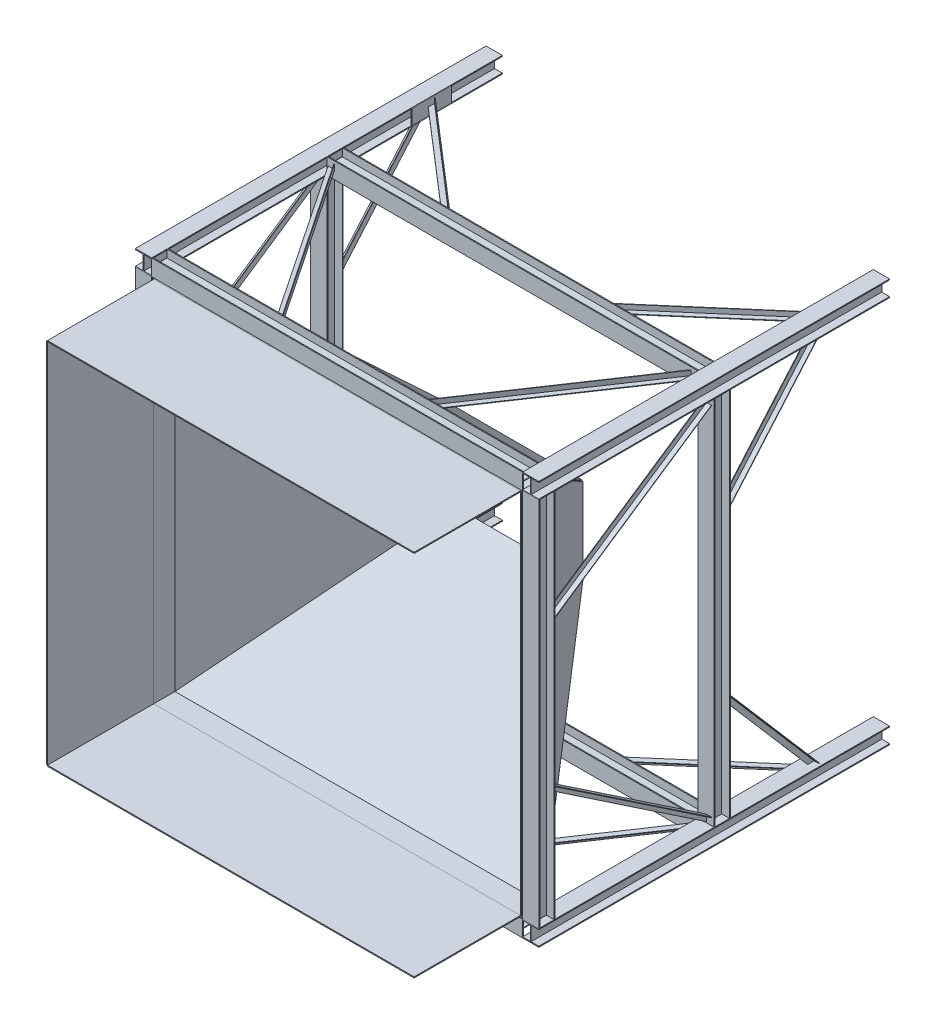
from build123d import *

# Parameters (mm, degrees)
COLUMNA_H_1_DEPTH                            = 3300
COLUMNA_H_2_DEPTH                            = 3300
COLUMNA_H_3_DEPTH                            = 3300
COLUMNA_H_4_DEPTH                            = 3300
VIGA_H_CARGA_1650_DEPTH                      = 3490
VIGA_H_CARGA_3300_DEPTH                      = 3490
CONTORNO_CIERRE_COLUMNA_CARGA_A_W            = 370
CONTORNO_CIERRE_COLUMNA_CARGA_A_H            = 135
CIERRE_COLUMNA_CARGA_A_DEPTH                 = 8
ALA_PLANA_ANGULAR_SUPERIOR_CARGA_A_DEPTH     = 5
RETORNO_ANGULAR_SUPERIOR_CARGA_A_DEPTH       = 45
ALA_PLANA_ANGULAR_INFERIOR_CARGA_A_DEPTH     = 5
RETORNO_ANGULAR_INFERIOR_CARGA_A_DEPTH       = 45
CONTORNO_CIERRE_COLUMNA_CARGA_B_W            = 370
CONTORNO_CIERRE_COLUMNA_CARGA_B_H            = 135
CIERRE_COLUMNA_CARGA_B_DEPTH                 = 8
ALA_PLANA_ANGULAR_SUPERIOR_CARGA_B_DEPTH     = 5
RETORNO_ANGULAR_SUPERIOR_CARGA_B_DEPTH       = 45
ALA_PLANA_ANGULAR_INFERIOR_CARGA_B_DEPTH     = 5
RETORNO_ANGULAR_INFERIOR_CARGA_B_DEPTH       = 45
CONTORNO_ASIENTO_SOLDADO_CARGA_W             = 2900
CONTORNO_ASIENTO_SOLDADO_CARGA_H             = 83.725
ASIENTO_SOLDADO_CARGA_DEPTH                  = 9.525
VIGA_H_FONDO_1650_DEPTH                      = 3490
VIGA_H_FONDO_3300_DEPTH                      = 3490
CONTORNO_CIERRE_COLUMNA_FONDO_A_W            = 370
CONTORNO_CIERRE_COLUMNA_FONDO_A_H            = 135
CIERRE_COLUMNA_FONDO_A_DEPTH                 = 8
ALA_PLANA_ANGULAR_SUPERIOR_FONDO_A_DEPTH     = 5
RETORNO_ANGULAR_SUPERIOR_FONDO_A_DEPTH       = 45
ALA_PLANA_ANGULAR_INFERIOR_FONDO_A_DEPTH     = 5
RETORNO_ANGULAR_INFERIOR_FONDO_A_DEPTH       = 45
CONTORNO_CIERRE_COLUMNA_FONDO_B_W            = 370
CONTORNO_CIERRE_COLUMNA_FONDO_B_H            = 135
CIERRE_COLUMNA_FONDO_B_DEPTH                 = 8
ALA_PLANA_ANGULAR_SUPERIOR_FONDO_B_DEPTH     = 5
RETORNO_ANGULAR_SUPERIOR_FONDO_B_DEPTH       = 45
ALA_PLANA_ANGULAR_INFERIOR_FONDO_B_DEPTH     = 5
RETORNO_ANGULAR_INFERIOR_FONDO_B_DEPTH       = 45
CONTORNO_ASIENTO_SOLDADO_FONDO_W             = 2900
CONTORNO_ASIENTO_SOLDADO_FONDO_H             = 83.725
ASIENTO_SOLDADO_FONDO_DEPTH                  = 9.525
VIGA_H_IZQUIERDA_1650_DEPTH                  = 3490
VIGA_H_IZQUIERDA_3300_DEPTH                  = 3490
ALA_PLANA_ANGULAR_SUPERIOR_IZQUIERDA_A_DEPTH = 5
RETORNO_ANGULAR_SUPERIOR_IZQUIERDA_A_DEPTH   = 45
ALA_PLANA_ANGULAR_INFERIOR_IZQUIERDA_A_DEPTH = 5
RETORNO_ANGULAR_INFERIOR_IZQUIERDA_A_DEPTH   = 45
ALA_PLANA_ANGULAR_SUPERIOR_IZQUIERDA_B_DEPTH = 5
RETORNO_ANGULAR_SUPERIOR_IZQUIERDA_B_DEPTH   = 45
ALA_PLANA_ANGULAR_INFERIOR_IZQUIERDA_B_DEPTH = 5
RETORNO_ANGULAR_INFERIOR_IZQUIERDA_B_DEPTH   = 45
CONTORNO_ASIENTO_SOLDADO_IZQUIERDA_W         = 83.725
CONTORNO_ASIENTO_SOLDADO_IZQUIERDA_H         = 2900
ASIENTO_SOLDADO_IZQUIERDA_DEPTH              = 9.525
VIGA_H_DERECHA_1650_DEPTH                    = 3490
VIGA_H_DERECHA_3300_DEPTH                    = 3490
ALA_PLANA_ANGULAR_SUPERIOR_DERECHA_A_DEPTH   = 5
RETORNO_ANGULAR_SUPERIOR_DERECHA_A_DEPTH     = 45
ALA_PLANA_ANGULAR_INFERIOR_DERECHA_A_DEPTH   = 5
RETORNO_ANGULAR_INFERIOR_DERECHA_A_DEPTH     = 45
ALA_PLANA_ANGULAR_SUPERIOR_DERECHA_B_DEPTH   = 5
RETORNO_ANGULAR_SUPERIOR_DERECHA_B_DEPTH     = 45
ALA_PLANA_ANGULAR_INFERIOR_DERECHA_B_DEPTH   = 5
RETORNO_ANGULAR_INFERIOR_DERECHA_B_DEPTH     = 45
CONTORNO_ASIENTO_SOLDADO_DERECHA_W           = 83.725
CONTORNO_ASIENTO_SOLDADO_DERECHA_H           = 2900
ASIENTO_SOLDADO_DERECHA_DEPTH                = 9.525
CONTORNO_COLLAR_LATERAL_Y_NEGATIVO_W         = 3450
CONTORNO_COLLAR_LATERAL_Y_NEGATIVO_H         = 200
COLLAR_LATERAL_Y_NEGATIVO_DEPTH              = 9.525
CONTORNO_ALER_N_LATERAL_Y_NEGATIVO_W         = 3450
CONTORNO_ALER_N_LATERAL_Y_NEGATIVO_H         = 1000
ALER_N_LATERAL_Y_NEGATIVO_DEPTH              = 9.525
EMBUDO_LATERAL_Y_NEGATIVO_DEPTH              = 9.525
CONTORNO_COLLAR_CARGA_W                      = 200
CONTORNO_COLLAR_CARGA_H                      = 3450
COLLAR_CARGA_DEPTH                           = 9.525
EMBUDO_CARGA_DEPTH                           = 9.525
CONTORNO_COLLAR_LATERAL_Y_POSITIVO_W         = 3450
CONTORNO_COLLAR_LATERAL_Y_POSITIVO_H         = 200
COLLAR_LATERAL_Y_POSITIVO_DEPTH              = 9.525
CONTORNO_ALER_N_LATERAL_Y_POSITIVO_W         = 3450
CONTORNO_ALER_N_LATERAL_Y_POSITIVO_H         = 1000
ALER_N_LATERAL_Y_POSITIVO_DEPTH              = 9.525
EMBUDO_LATERAL_Y_POSITIVO_DEPTH              = 9.525
CONTORNO_COLLAR_FONDO_X_NEGATIVO_W           = 200
CONTORNO_COLLAR_FONDO_X_NEGATIVO_H           = 3450
COLLAR_FONDO_X_NEGATIVO_DEPTH                = 9.525
CONTORNO_ALER_N_FONDO_X_NEGATIVO_W           = 1000
CONTORNO_ALER_N_FONDO_X_NEGATIVO_H           = 3450
ALER_N_FONDO_X_NEGATIVO_DEPTH                = 9.525
EMBUDO_FONDO_X_NEGATIVO_DEPTH                = 9.525


with BuildPart() as part:
    # Contorno Columna H 1 → Columna H 1 (new body)
    with BuildSketch(Plane.XY):
        Polygon((-1898, -1898), (-1745, -1898), (-1745, -1889), (-1818.25, -1889), (-1818.25, -1754), (-1745, -1754), (-1745, -1745), (-1898, -1745), (-1898, -1754), (-1824.75, -1754), (-1824.75, -1889), (-1898, -1889), align=None)
    extrude(amount=COLUMNA_H_1_DEPTH)


with BuildPart() as body_2:
    # Contorno Columna H 2 → Columna H 2 (new body)
    with BuildSketch(Plane.XY):
        Polygon((-1898, 1745), (-1745, 1745), (-1745, 1754), (-1818.25, 1754), (-1818.25, 1889), (-1745, 1889), (-1745, 1898), (-1898, 1898), (-1898, 1889), (-1824.75, 1889), (-1824.75, 1754), (-1898, 1754), align=None)
    extrude(amount=COLUMNA_H_2_DEPTH)


with BuildPart() as body_3:
    # Contorno Columna H 3 → Columna H 3 (new body)
    with BuildSketch(Plane.XY):
        Polygon((1745, -1898), (1898, -1898), (1898, -1889), (1824.75, -1889), (1824.75, -1754), (1898, -1754), (1898, -1745), (1745, -1745), (1745, -1754), (1818.25, -1754), (1818.25, -1889), (1745, -1889), align=None)
    extrude(amount=COLUMNA_H_3_DEPTH)


with BuildPart() as body_4:
    # Contorno Columna H 4 → Columna H 4 (new body)
    with BuildSketch(Plane.XY):
        Polygon((1745, 1745), (1898, 1745), (1898, 1754), (1824.75, 1754), (1824.75, 1889), (1898, 1889), (1898, 1898), (1745, 1898), (1745, 1889), (1818.25, 1889), (1818.25, 1754), (1745, 1754), align=None)
    extrude(amount=COLUMNA_H_4_DEPTH)


with BuildPart() as body_5:
    # Contorno Viga H carga 1650 → Viga H carga 1650 (new body)
    with BuildSketch(Plane(origin=(-1745, 0, 0), x_dir=(0, 0, -1), z_dir=(1, 0, 0))):
        Polygon((-1497, -1745), (-1497, -1898), (-1506, -1898), (-1506, -1824.75), (-1641, -1824.75), (-1641, -1898), (-1650, -1898), (-1650, -1745), (-1641, -1745), (-1641, -1818.25), (-1506, -1818.25), (-1506, -1745), align=None)
    extrude(amount=VIGA_H_CARGA_1650_DEPTH)


with BuildPart() as body_6:
    # Contorno Viga H carga 3300 → Viga H carga 3300 (new body)
    with BuildSketch(Plane(origin=(-1745, 0, 0), x_dir=(0, 0, -1), z_dir=(1, 0, 0))):
        Polygon((-3147, -1745), (-3147, -1898), (-3156, -1898), (-3156, -1824.75), (-3291, -1824.75), (-3291, -1898), (-3300, -1898), (-3300, -1745), (-3291, -1745), (-3291, -1818.25), (-3156, -1818.25), (-3156, -1745), align=None)
    extrude(amount=VIGA_H_CARGA_3300_DEPTH)


with BuildPart() as body_7:
    # Contorno Cierre columna carga A → Cierre columna carga A (new body)
    with BuildSketch(Plane(origin=(-1745, 0, 0), x_dir=(0, 0, -1), z_dir=(1, 0, 0))):
        with Locations((-665, -1821.5)):
            Rectangle(CONTORNO_CIERRE_COLUMNA_CARGA_A_W, CONTORNO_CIERRE_COLUMNA_CARGA_A_H)
    extrude(amount=-CIERRE_COLUMNA_CARGA_A_DEPTH)


with BuildPart() as body_8:
    # Contorno Ala plana Angular superior carg → Ala plana Angular superior carga A (new body)
    with BuildSketch(Plane(origin=(0, -1821.5, 0), x_dir=(1, 0, 0), z_dir=(0, 1, 0))):
        Polygon((-1674.870108064, -1650), (-1735.129891936, -1650), (-728.129891936, -3147), (-667.870108064, -3147), align=None)
    extrude(amount=-ALA_PLANA_ANGULAR_SUPERIOR_CARGA_A_DEPTH)


with BuildPart() as body_9:
    # Contorno Retorno Angular superior carga → Retorno Angular superior carga A (new body)
    with BuildSketch(Plane(origin=(0, -1826.5, 0), x_dir=(1, 0, 0), z_dir=(0, 1, 0))):
        Polygon((-1674.870108064, -1650), (-1680.896086451, -1650), (-673.896086451, -3147), (-667.870108064, -3147), align=None)
    extrude(amount=-RETORNO_ANGULAR_SUPERIOR_CARGA_A_DEPTH)


with BuildPart() as body_8_1:
    add(body_8.part)

    # Angular superior carga A: union body 9
    add(body_9.part)


with BuildPart() as body_9_2:
    # Contorno Ala plana Angular inferior carg → Ala plana Angular inferior carga A (new body)
    with BuildSketch(Plane(origin=(0, -1821.5, 0), x_dir=(1, 0, 0), z_dir=(0, 1, 0))):
        Polygon((-1745, -631.991026401), (-1745, -698.008973599), (-818.285648465, -1497), (-741.714351535, -1497), align=None)
    extrude(amount=-ALA_PLANA_ANGULAR_INFERIOR_CARGA_A_DEPTH)


with BuildPart() as body_10:
    # Contorno Retorno Angular inferior carga → Retorno Angular inferior carga A (new body)
    with BuildSketch(Plane(origin=(0, -1826.5, 0), x_dir=(1, 0, 0), z_dir=(0, 1, 0))):
        Polygon((-1745, -631.991026401), (-1745, -638.592821121), (-749.371481228, -1497), (-741.714351535, -1497), align=None)
    extrude(amount=-RETORNO_ANGULAR_INFERIOR_CARGA_A_DEPTH)


with BuildPart() as body_9_2_1:
    add(body_9_2.part)

    # Angular inferior carga A: union body 10
    add(body_10.part)


with BuildPart() as body_10_2:
    # Contorno Cierre columna carga B → Cierre columna carga B (new body)
    with BuildSketch(Plane(origin=(1745, 0, 0), x_dir=(0, 0, -1), z_dir=(1, 0, 0))):
        with Locations((-665, -1821.5)):
            Rectangle(CONTORNO_CIERRE_COLUMNA_CARGA_B_W, CONTORNO_CIERRE_COLUMNA_CARGA_B_H)
    extrude(amount=CIERRE_COLUMNA_CARGA_B_DEPTH)


with BuildPart() as body_11:
    # Contorno Ala plana Angular superior  2 → Ala plana Angular superior carga B (new body)
    with BuildSketch(Plane(origin=(0, -1821.5, 0), x_dir=(1, 0, 0), z_dir=(0, 1, 0))):
        Polygon((1674.870108064, -1650), (1735.129891936, -1650), (728.129891936, -3147), (667.870108064, -3147), align=None)
    extrude(amount=-ALA_PLANA_ANGULAR_SUPERIOR_CARGA_B_DEPTH)


with BuildPart() as body_12:
    # Contorno Retorno Angular superior ca 2 → Retorno Angular superior carga B (new body)
    with BuildSketch(Plane(origin=(0, -1826.5, 0), x_dir=(1, 0, 0), z_dir=(0, 1, 0))):
        Polygon((1674.870108064, -1650), (1680.896086451, -1650), (673.896086451, -3147), (667.870108064, -3147), align=None)
    extrude(amount=-RETORNO_ANGULAR_SUPERIOR_CARGA_B_DEPTH)


with BuildPart() as body_11_1:
    add(body_11.part)

    # Angular superior carga B: union body 12
    add(body_12.part)


with BuildPart() as body_12_2:
    # Contorno Ala plana Angular inferior  2 → Ala plana Angular inferior carga B (new body)
    with BuildSketch(Plane(origin=(0, -1821.5, 0), x_dir=(1, 0, 0), z_dir=(0, 1, 0))):
        Polygon((1745, -631.991026401), (1745, -698.008973599), (818.285648465, -1497), (741.714351535, -1497), align=None)
    extrude(amount=-ALA_PLANA_ANGULAR_INFERIOR_CARGA_B_DEPTH)


with BuildPart() as body_13:
    # Contorno Retorno Angular inferior ca 2 → Retorno Angular inferior carga B (new body)
    with BuildSketch(Plane(origin=(0, -1826.5, 0), x_dir=(1, 0, 0), z_dir=(0, 1, 0))):
        Polygon((1745, -631.991026401), (1745, -638.592821121), (749.371481228, -1497), (741.714351535, -1497), align=None)
    extrude(amount=-RETORNO_ANGULAR_INFERIOR_CARGA_B_DEPTH)


with BuildPart() as body_12_2_1:
    add(body_12_2.part)

    # Angular inferior carga B: union body 13
    add(body_13.part)


with BuildPart() as body_13_2:
    # Contorno Asiento soldado carga → Asiento soldado carga (new body)
    with BuildSketch(Plane.XY.offset(3281.475)):
        with Locations((0, -1776.3875)):
            Rectangle(CONTORNO_ASIENTO_SOLDADO_CARGA_W, CONTORNO_ASIENTO_SOLDADO_CARGA_H)
    extrude(amount=ASIENTO_SOLDADO_CARGA_DEPTH)


with BuildPart() as body_14:
    # Contorno Viga H fondo 1650 → Viga H fondo 1650 (new body)
    with BuildSketch(Plane(origin=(-1745, 0, 0), x_dir=(0, 0, -1), z_dir=(1, 0, 0))):
        Polygon((-1497, 1745), (-1497, 1898), (-1506, 1898), (-1506, 1824.75), (-1641, 1824.75), (-1641, 1898), (-1650, 1898), (-1650, 1745), (-1641, 1745), (-1641, 1818.25), (-1506, 1818.25), (-1506, 1745), align=None)
    extrude(amount=VIGA_H_FONDO_1650_DEPTH)


with BuildPart() as body_15:
    # Contorno Viga H fondo 3300 → Viga H fondo 3300 (new body)
    with BuildSketch(Plane(origin=(-1745, 0, 0), x_dir=(0, 0, -1), z_dir=(1, 0, 0))):
        Polygon((-3147, 1745), (-3147, 1898), (-3156, 1898), (-3156, 1824.75), (-3291, 1824.75), (-3291, 1898), (-3300, 1898), (-3300, 1745), (-3291, 1745), (-3291, 1818.25), (-3156, 1818.25), (-3156, 1745), align=None)
    extrude(amount=VIGA_H_FONDO_3300_DEPTH)


with BuildPart() as body_16:
    # Contorno Cierre columna fondo A → Cierre columna fondo A (new body)
    with BuildSketch(Plane(origin=(-1745, 0, 0), x_dir=(0, 0, -1), z_dir=(1, 0, 0))):
        with Locations((-665, 1821.5)):
            Rectangle(CONTORNO_CIERRE_COLUMNA_FONDO_A_W, CONTORNO_CIERRE_COLUMNA_FONDO_A_H)
    extrude(amount=-CIERRE_COLUMNA_FONDO_A_DEPTH)


with BuildPart() as body_17:
    # Contorno Ala plana Angular superior fond → Ala plana Angular superior fondo A (new body)
    with BuildSketch(Plane(origin=(0, 1821.5, 0), x_dir=(1, 0, 0), z_dir=(0, 1, 0))):
        Polygon((-1674.870108064, -1650), (-1735.129891936, -1650), (-728.129891936, -3147), (-667.870108064, -3147), align=None)
    extrude(amount=ALA_PLANA_ANGULAR_SUPERIOR_FONDO_A_DEPTH)


with BuildPart() as body_18:
    # Contorno Retorno Angular superior fondo → Retorno Angular superior fondo A (new body)
    with BuildSketch(Plane(origin=(0, 1826.5, 0), x_dir=(1, 0, 0), z_dir=(0, 1, 0))):
        Polygon((-1674.870108064, -1650), (-1680.896086451, -1650), (-673.896086451, -3147), (-667.870108064, -3147), align=None)
    extrude(amount=RETORNO_ANGULAR_SUPERIOR_FONDO_A_DEPTH)


with BuildPart() as body_17_1:
    add(body_17.part)

    # Angular superior fondo A: union body 18
    add(body_18.part)


with BuildPart() as body_18_2:
    # Contorno Ala plana Angular inferior fond → Ala plana Angular inferior fondo A (new body)
    with BuildSketch(Plane(origin=(0, 1821.5, 0), x_dir=(1, 0, 0), z_dir=(0, 1, 0))):
        Polygon((-1745, -631.991026401), (-1745, -698.008973599), (-818.285648465, -1497), (-741.714351535, -1497), align=None)
    extrude(amount=ALA_PLANA_ANGULAR_INFERIOR_FONDO_A_DEPTH)


with BuildPart() as body_19:
    # Contorno Retorno Angular inferior fondo → Retorno Angular inferior fondo A (new body)
    with BuildSketch(Plane(origin=(0, 1826.5, 0), x_dir=(1, 0, 0), z_dir=(0, 1, 0))):
        Polygon((-1745, -631.991026401), (-1745, -638.592821121), (-749.371481228, -1497), (-741.714351535, -1497), align=None)
    extrude(amount=RETORNO_ANGULAR_INFERIOR_FONDO_A_DEPTH)


with BuildPart() as body_18_2_1:
    add(body_18_2.part)

    # Angular inferior fondo A: union body 19
    add(body_19.part)


with BuildPart() as body_19_2:
    # Contorno Cierre columna fondo B → Cierre columna fondo B (new body)
    with BuildSketch(Plane(origin=(1745, 0, 0), x_dir=(0, 0, -1), z_dir=(1, 0, 0))):
        with Locations((-665, 1821.5)):
            Rectangle(CONTORNO_CIERRE_COLUMNA_FONDO_B_W, CONTORNO_CIERRE_COLUMNA_FONDO_B_H)
    extrude(amount=CIERRE_COLUMNA_FONDO_B_DEPTH)


with BuildPart() as body_20:
    # Contorno Ala plana Angular superior  3 → Ala plana Angular superior fondo B (new body)
    with BuildSketch(Plane(origin=(0, 1821.5, 0), x_dir=(1, 0, 0), z_dir=(0, 1, 0))):
        Polygon((1674.870108064, -1650), (1735.129891936, -1650), (728.129891936, -3147), (667.870108064, -3147), align=None)
    extrude(amount=ALA_PLANA_ANGULAR_SUPERIOR_FONDO_B_DEPTH)


with BuildPart() as body_21:
    # Contorno Retorno Angular superior fo 2 → Retorno Angular superior fondo B (new body)
    with BuildSketch(Plane(origin=(0, 1826.5, 0), x_dir=(1, 0, 0), z_dir=(0, 1, 0))):
        Polygon((1674.870108064, -1650), (1680.896086451, -1650), (673.896086451, -3147), (667.870108064, -3147), align=None)
    extrude(amount=RETORNO_ANGULAR_SUPERIOR_FONDO_B_DEPTH)


with BuildPart() as body_20_1:
    add(body_20.part)

    # Angular superior fondo B: union body 21
    add(body_21.part)


with BuildPart() as body_21_2:
    # Contorno Ala plana Angular inferior  3 → Ala plana Angular inferior fondo B (new body)
    with BuildSketch(Plane(origin=(0, 1821.5, 0), x_dir=(1, 0, 0), z_dir=(0, 1, 0))):
        Polygon((1745, -631.991026401), (1745, -698.008973599), (818.285648465, -1497), (741.714351535, -1497), align=None)
    extrude(amount=ALA_PLANA_ANGULAR_INFERIOR_FONDO_B_DEPTH)


with BuildPart() as body_22:
    # Contorno Retorno Angular inferior fo 2 → Retorno Angular inferior fondo B (new body)
    with BuildSketch(Plane(origin=(0, 1826.5, 0), x_dir=(1, 0, 0), z_dir=(0, 1, 0))):
        Polygon((1745, -631.991026401), (1745, -638.592821121), (749.371481228, -1497), (741.714351535, -1497), align=None)
    extrude(amount=RETORNO_ANGULAR_INFERIOR_FONDO_B_DEPTH)


with BuildPart() as body_21_2_1:
    add(body_21_2.part)

    # Angular inferior fondo B: union body 22
    add(body_22.part)


with BuildPart() as body_22_2:
    # Contorno Asiento soldado fondo → Asiento soldado fondo (new body)
    with BuildSketch(Plane.XY.offset(3281.475)):
        with Locations((0, 1776.3875)):
            Rectangle(CONTORNO_ASIENTO_SOLDADO_FONDO_W, CONTORNO_ASIENTO_SOLDADO_FONDO_H)
    extrude(amount=ASIENTO_SOLDADO_FONDO_DEPTH)


with BuildPart() as body_23:
    # Contorno Viga H izquierda 1650 → Viga H izquierda 1650 (new body)
    with BuildSketch(Plane(origin=(0, -1745, 0), x_dir=(1, 0, 0), z_dir=(0, 1, 0))):
        Polygon((-1745, -1497), (-1898, -1497), (-1898, -1506), (-1824.75, -1506), (-1824.75, -1641), (-1898, -1641), (-1898, -1650), (-1745, -1650), (-1745, -1641), (-1818.25, -1641), (-1818.25, -1506), (-1745, -1506), align=None)
    extrude(amount=VIGA_H_IZQUIERDA_1650_DEPTH)


with BuildPart() as body_24:
    # Contorno Viga H izquierda 3300 → Viga H izquierda 3300 (new body)
    with BuildSketch(Plane(origin=(0, -1745, 0), x_dir=(1, 0, 0), z_dir=(0, 1, 0))):
        Polygon((-1745, -3147), (-1898, -3147), (-1898, -3156), (-1824.75, -3156), (-1824.75, -3291), (-1898, -3291), (-1898, -3300), (-1745, -3300), (-1745, -3291), (-1818.25, -3291), (-1818.25, -3156), (-1745, -3156), align=None)
    extrude(amount=VIGA_H_IZQUIERDA_3300_DEPTH)


with BuildPart() as body_25:
    # Contorno Ala plana Angular superior izqu → Ala plana Angular superior izquierda A (new body)
    with BuildSketch(Plane(origin=(-1821.5, 0, 0), x_dir=(0, 0, -1), z_dir=(1, 0, 0))):
        Polygon((-1650, -1674.870108064), (-1650, -1735.129891936), (-3147, -728.129891936), (-3147, -667.870108064), align=None)
    extrude(amount=-ALA_PLANA_ANGULAR_SUPERIOR_IZQUIERDA_A_DEPTH)


with BuildPart() as body_26:
    # Contorno Retorno Angular superior izquie → Retorno Angular superior izquierda A (new body)
    with BuildSketch(Plane(origin=(-1826.5, 0, 0), x_dir=(0, 0, -1), z_dir=(1, 0, 0))):
        Polygon((-1650, -1674.870108064), (-1650, -1680.896086451), (-3147, -673.896086451), (-3147, -667.870108064), align=None)
    extrude(amount=-RETORNO_ANGULAR_SUPERIOR_IZQUIERDA_A_DEPTH)


with BuildPart() as body_25_1:
    add(body_25.part)

    # Angular superior izquierda A: union body 26
    add(body_26.part)


with BuildPart() as body_26_2:
    # Contorno Ala plana Angular inferior izqu → Ala plana Angular inferior izquierda A (new body)
    with BuildSketch(Plane(origin=(-1821.5, 0, 0), x_dir=(0, 0, -1), z_dir=(1, 0, 0))):
        Polygon((-631.991026401, -1745), (-698.008973599, -1745), (-1497, -818.285648465), (-1497, -741.714351535), align=None)
    extrude(amount=-ALA_PLANA_ANGULAR_INFERIOR_IZQUIERDA_A_DEPTH)


with BuildPart() as body_27:
    # Contorno Retorno Angular inferior izquie → Retorno Angular inferior izquierda A (new body)
    with BuildSketch(Plane(origin=(-1826.5, 0, 0), x_dir=(0, 0, -1), z_dir=(1, 0, 0))):
        Polygon((-631.991026401, -1745), (-638.592821121, -1745), (-1497, -749.371481228), (-1497, -741.714351535), align=None)
    extrude(amount=-RETORNO_ANGULAR_INFERIOR_IZQUIERDA_A_DEPTH)


with BuildPart() as body_26_2_1:
    add(body_26_2.part)

    # Angular inferior izquierda A: union body 27
    add(body_27.part)


with BuildPart() as body_27_2:
    # Contorno Ala plana Angular superior  4 → Ala plana Angular superior izquierda B (new body)
    with BuildSketch(Plane(origin=(-1821.5, 0, 0), x_dir=(0, 0, -1), z_dir=(1, 0, 0))):
        Polygon((-1650, 1674.870108064), (-1650, 1735.129891936), (-3147, 728.129891936), (-3147, 667.870108064), align=None)
    extrude(amount=-ALA_PLANA_ANGULAR_SUPERIOR_IZQUIERDA_B_DEPTH)


with BuildPart() as body_28:
    # Contorno Retorno Angular superior iz 2 → Retorno Angular superior izquierda B (new body)
    with BuildSketch(Plane(origin=(-1826.5, 0, 0), x_dir=(0, 0, -1), z_dir=(1, 0, 0))):
        Polygon((-1650, 1674.870108064), (-1650, 1680.896086451), (-3147, 673.896086451), (-3147, 667.870108064), align=None)
    extrude(amount=-RETORNO_ANGULAR_SUPERIOR_IZQUIERDA_B_DEPTH)


with BuildPart() as body_27_2_1:
    add(body_27_2.part)

    # Angular superior izquierda B: union body 28
    add(body_28.part)


with BuildPart() as body_28_2:
    # Contorno Ala plana Angular inferior  4 → Ala plana Angular inferior izquierda B (new body)
    with BuildSketch(Plane(origin=(-1821.5, 0, 0), x_dir=(0, 0, -1), z_dir=(1, 0, 0))):
        Polygon((-631.991026401, 1745), (-698.008973599, 1745), (-1497, 818.285648465), (-1497, 741.714351535), align=None)
    extrude(amount=-ALA_PLANA_ANGULAR_INFERIOR_IZQUIERDA_B_DEPTH)


with BuildPart() as body_29:
    # Contorno Retorno Angular inferior iz 2 → Retorno Angular inferior izquierda B (new body)
    with BuildSketch(Plane(origin=(-1826.5, 0, 0), x_dir=(0, 0, -1), z_dir=(1, 0, 0))):
        Polygon((-631.991026401, 1745), (-638.592821121, 1745), (-1497, 749.371481228), (-1497, 741.714351535), align=None)
    extrude(amount=-RETORNO_ANGULAR_INFERIOR_IZQUIERDA_B_DEPTH)


with BuildPart() as body_28_2_1:
    add(body_28_2.part)

    # Angular inferior izquierda B: union body 29
    add(body_29.part)


with BuildPart() as body_29_2:
    # Contorno Asiento soldado izquierda → Asiento soldado izquierda (new body)
    with BuildSketch(Plane.XY.offset(3281.475)):
        with Locations((-1776.3875, 0)):
            Rectangle(CONTORNO_ASIENTO_SOLDADO_IZQUIERDA_W, CONTORNO_ASIENTO_SOLDADO_IZQUIERDA_H)
    extrude(amount=ASIENTO_SOLDADO_IZQUIERDA_DEPTH)


with BuildPart() as body_30:
    # Contorno Viga H derecha 1650 → Viga H derecha 1650 (new body)
    with BuildSketch(Plane(origin=(0, -1745, 0), x_dir=(1, 0, 0), z_dir=(0, 1, 0))):
        Polygon((1745, -1497), (1898, -1497), (1898, -1506), (1824.75, -1506), (1824.75, -1641), (1898, -1641), (1898, -1650), (1745, -1650), (1745, -1641), (1818.25, -1641), (1818.25, -1506), (1745, -1506), align=None)
    extrude(amount=VIGA_H_DERECHA_1650_DEPTH)


with BuildPart() as body_31:
    # Contorno Viga H derecha 3300 → Viga H derecha 3300 (new body)
    with BuildSketch(Plane(origin=(0, -1745, 0), x_dir=(1, 0, 0), z_dir=(0, 1, 0))):
        Polygon((1745, -3147), (1898, -3147), (1898, -3156), (1824.75, -3156), (1824.75, -3291), (1898, -3291), (1898, -3300), (1745, -3300), (1745, -3291), (1818.25, -3291), (1818.25, -3156), (1745, -3156), align=None)
    extrude(amount=VIGA_H_DERECHA_3300_DEPTH)


with BuildPart() as body_32:
    # Contorno Ala plana Angular superior dere → Ala plana Angular superior derecha A (new body)
    with BuildSketch(Plane(origin=(1821.5, 0, 0), x_dir=(0, 0, -1), z_dir=(1, 0, 0))):
        Polygon((-1650, -1674.870108064), (-1650, -1735.129891936), (-3147, -728.129891936), (-3147, -667.870108064), align=None)
    extrude(amount=ALA_PLANA_ANGULAR_SUPERIOR_DERECHA_A_DEPTH)


with BuildPart() as body_33:
    # Contorno Retorno Angular superior derech → Retorno Angular superior derecha A (new body)
    with BuildSketch(Plane(origin=(1826.5, 0, 0), x_dir=(0, 0, -1), z_dir=(1, 0, 0))):
        Polygon((-1650, -1674.870108064), (-1650, -1680.896086451), (-3147, -673.896086451), (-3147, -667.870108064), align=None)
    extrude(amount=RETORNO_ANGULAR_SUPERIOR_DERECHA_A_DEPTH)


with BuildPart() as body_32_1:
    add(body_32.part)

    # Angular superior derecha A: union body 33
    add(body_33.part)


with BuildPart() as body_33_2:
    # Contorno Ala plana Angular inferior dere → Ala plana Angular inferior derecha A (new body)
    with BuildSketch(Plane(origin=(1821.5, 0, 0), x_dir=(0, 0, -1), z_dir=(1, 0, 0))):
        Polygon((-631.991026401, -1745), (-698.008973599, -1745), (-1497, -818.285648465), (-1497, -741.714351535), align=None)
    extrude(amount=ALA_PLANA_ANGULAR_INFERIOR_DERECHA_A_DEPTH)


with BuildPart() as body_34:
    # Contorno Retorno Angular inferior derech → Retorno Angular inferior derecha A (new body)
    with BuildSketch(Plane(origin=(1826.5, 0, 0), x_dir=(0, 0, -1), z_dir=(1, 0, 0))):
        Polygon((-631.991026401, -1745), (-638.592821121, -1745), (-1497, -749.371481228), (-1497, -741.714351535), align=None)
    extrude(amount=RETORNO_ANGULAR_INFERIOR_DERECHA_A_DEPTH)


with BuildPart() as body_33_2_1:
    add(body_33_2.part)

    # Angular inferior derecha A: union body 34
    add(body_34.part)


with BuildPart() as body_34_2:
    # Contorno Ala plana Angular superior  5 → Ala plana Angular superior derecha B (new body)
    with BuildSketch(Plane(origin=(1821.5, 0, 0), x_dir=(0, 0, -1), z_dir=(1, 0, 0))):
        Polygon((-1650, 1674.870108064), (-1650, 1735.129891936), (-3147, 728.129891936), (-3147, 667.870108064), align=None)
    extrude(amount=ALA_PLANA_ANGULAR_SUPERIOR_DERECHA_B_DEPTH)


with BuildPart() as body_35:
    # Contorno Retorno Angular superior de 2 → Retorno Angular superior derecha B (new body)
    with BuildSketch(Plane(origin=(1826.5, 0, 0), x_dir=(0, 0, -1), z_dir=(1, 0, 0))):
        Polygon((-1650, 1674.870108064), (-1650, 1680.896086451), (-3147, 673.896086451), (-3147, 667.870108064), align=None)
    extrude(amount=RETORNO_ANGULAR_SUPERIOR_DERECHA_B_DEPTH)


with BuildPart() as body_34_2_1:
    add(body_34_2.part)

    # Angular superior derecha B: union body 35
    add(body_35.part)


with BuildPart() as body_35_2:
    # Contorno Ala plana Angular inferior  5 → Ala plana Angular inferior derecha B (new body)
    with BuildSketch(Plane(origin=(1821.5, 0, 0), x_dir=(0, 0, -1), z_dir=(1, 0, 0))):
        Polygon((-631.991026401, 1745), (-698.008973599, 1745), (-1497, 818.285648465), (-1497, 741.714351535), align=None)
    extrude(amount=ALA_PLANA_ANGULAR_INFERIOR_DERECHA_B_DEPTH)


with BuildPart() as body_36:
    # Contorno Retorno Angular inferior de 2 → Retorno Angular inferior derecha B (new body)
    with BuildSketch(Plane(origin=(1826.5, 0, 0), x_dir=(0, 0, -1), z_dir=(1, 0, 0))):
        Polygon((-631.991026401, 1745), (-638.592821121, 1745), (-1497, 749.371481228), (-1497, 741.714351535), align=None)
    extrude(amount=RETORNO_ANGULAR_INFERIOR_DERECHA_B_DEPTH)


with BuildPart() as body_35_2_1:
    add(body_35_2.part)

    # Angular inferior derecha B: union body 36
    add(body_36.part)


with BuildPart() as body_36_2:
    # Contorno Asiento soldado derecha → Asiento soldado derecha (new body)
    with BuildSketch(Plane.XY.offset(3281.475)):
        with Locations((1776.3875, 0)):
            Rectangle(CONTORNO_ASIENTO_SOLDADO_DERECHA_W, CONTORNO_ASIENTO_SOLDADO_DERECHA_H)
    extrude(amount=ASIENTO_SOLDADO_DERECHA_DEPTH)


with BuildPart() as body_37:
    # Contorno Collar lateral Y negativo → Collar lateral Y negativo (new body)
    with BuildSketch(Plane(origin=(0, -1725, 0), x_dir=(1, 0, 0), z_dir=(0, 1, 0))):
        with Locations((0, -3200)):
            Rectangle(CONTORNO_COLLAR_LATERAL_Y_NEGATIVO_W, CONTORNO_COLLAR_LATERAL_Y_NEGATIVO_H)
    extrude(amount=-COLLAR_LATERAL_Y_NEGATIVO_DEPTH)


with BuildPart() as body_38:
    # Contorno Alerón lateral Y negativo → Alerón lateral Y negativo (new body)
    with BuildSketch(Plane(origin=(0, -1725, 0), x_dir=(1, 0, 0), z_dir=(0, 1, 0))):
        with Locations((0, -3800)):
            Rectangle(CONTORNO_ALER_N_LATERAL_Y_NEGATIVO_W, CONTORNO_ALER_N_LATERAL_Y_NEGATIVO_H)
    extrude(amount=-ALER_N_LATERAL_Y_NEGATIVO_DEPTH)


with BuildPart() as body_39:
    # Contorno Embudo lateral Y negativo → Embudo lateral Y negativo (new body)
    with BuildSketch(Plane(origin=(0, 569.199563114, 502.792947418), x_dir=(1, 0, 0), z_dir=(0, 0.7494732117818854, 0.6620346704073324))):
        Polygon((-1725, -3465.376762976), (1725, -3465.376762976), (600, -1463.971007014), (-600, -1463.971007014), align=None)
    extrude(amount=-EMBUDO_LATERAL_Y_NEGATIVO_DEPTH)


with BuildPart() as body_40:
    # Contorno Collar carga → Collar carga (new body)
    with BuildSketch(Plane(origin=(1725, 0, 0), x_dir=(0, 0, -1), z_dir=(1, 0, 0))):
        with Locations((-3200, 0)):
            Rectangle(CONTORNO_COLLAR_CARGA_W, CONTORNO_COLLAR_CARGA_H)
    extrude(amount=COLLAR_CARGA_DEPTH)


with BuildPart() as body_41:
    # Contorno Embudo carga → Embudo carga (new body)
    with BuildSketch(Plane(origin=(-384, 0, 288), x_dir=(-0.6000000000000002, 0, -0.7999999999999999), z_dir=(0.7999999999999998, 0, -0.6000000000000001))):
        Polygon((-3515, -1725), (-3515, 1725), (-1640, 400), (-1640, -400), align=None)
    extrude(amount=EMBUDO_CARGA_DEPTH)


with BuildPart() as body_42:
    # Contorno Collar lateral Y positivo → Collar lateral Y positivo (new body)
    with BuildSketch(Plane(origin=(0, 1725, 0), x_dir=(1, 0, 0), z_dir=(0, 1, 0))):
        with Locations((0, -3200)):
            Rectangle(CONTORNO_COLLAR_LATERAL_Y_POSITIVO_W, CONTORNO_COLLAR_LATERAL_Y_POSITIVO_H)
    extrude(amount=COLLAR_LATERAL_Y_POSITIVO_DEPTH)


with BuildPart() as body_43:
    # Contorno Alerón lateral Y positivo → Alerón lateral Y positivo (new body)
    with BuildSketch(Plane(origin=(0, 1725, 0), x_dir=(1, 0, 0), z_dir=(0, 1, 0))):
        with Locations((0, -3800)):
            Rectangle(CONTORNO_ALER_N_LATERAL_Y_POSITIVO_W, CONTORNO_ALER_N_LATERAL_Y_POSITIVO_H)
    extrude(amount=ALER_N_LATERAL_Y_POSITIVO_DEPTH)


with BuildPart() as body_44:
    # Contorno Embudo lateral Y positivo → Embudo lateral Y positivo (new body)
    with BuildSketch(Plane(origin=(0, -569.199563114, 502.792947418), x_dir=(1, 0, 0), z_dir=(0, 0.7494732117818854, -0.6620346704073324))):
        Polygon((1725, -3465.376762976), (-1725, -3465.376762976), (-600, -1463.971007014), (600, -1463.971007014), align=None)
    extrude(amount=EMBUDO_LATERAL_Y_POSITIVO_DEPTH)


with BuildPart() as body_45:
    # Contorno Collar fondo X negativo → Collar fondo X negativo (new body)
    with BuildSketch(Plane(origin=(-1725, 0, 0), x_dir=(0, 0, -1), z_dir=(1, 0, 0))):
        with Locations((-3200, 0)):
            Rectangle(CONTORNO_COLLAR_FONDO_X_NEGATIVO_W, CONTORNO_COLLAR_FONDO_X_NEGATIVO_H)
    extrude(amount=-COLLAR_FONDO_X_NEGATIVO_DEPTH)


with BuildPart() as body_46:
    # Contorno Alerón fondo X negativo → Alerón fondo X negativo (new body)
    with BuildSketch(Plane(origin=(-1725, 0, 0), x_dir=(0, 0, -1), z_dir=(1, 0, 0))):
        with Locations((-3800, 0)):
            Rectangle(CONTORNO_ALER_N_FONDO_X_NEGATIVO_W, CONTORNO_ALER_N_FONDO_X_NEGATIVO_H)
    extrude(amount=-ALER_N_FONDO_X_NEGATIVO_DEPTH)


with BuildPart() as body_47:
    # Contorno Embudo fondo X negativo → Embudo fondo X negativo (new body)
    with BuildSketch(Plane(origin=(384, 0, 288), x_dir=(0.6000000000000002, 0, -0.7999999999999999), z_dir=(0.7999999999999998, 0, 0.6000000000000001))):
        Polygon((-3515, 1725), (-3515, -1725), (-1640, -400), (-1640, 400), align=None)
    extrude(amount=-EMBUDO_FONDO_X_NEGATIVO_DEPTH)


solid = Compound([part.part, body_2.part, body_3.part, body_4.part, body_5.part, body_6.part, body_7.part, body_8_1.part, body_9_2_1.part, body_10_2.part, body_11_1.part, body_12_2_1.part, body_13_2.part, body_14.part, body_15.part, body_16.part, body_17_1.part, body_18_2_1.part, body_19_2.part, body_20_1.part, body_21_2_1.part, body_22_2.part, body_23.part, body_24.part, body_25_1.part, body_26_2_1.part, body_27_2_1.part, body_28_2_1.part, body_29_2.part, body_30.part, body_31.part, body_32_1.part, body_33_2_1.part, body_34_2_1.part, body_35_2_1.part, body_36_2.part, body_37.part, body_38.part, body_39.part, body_40.part, body_41.part, body_42.part, body_43.part, body_44.part, body_45.part, body_46.part, body_47.part])
